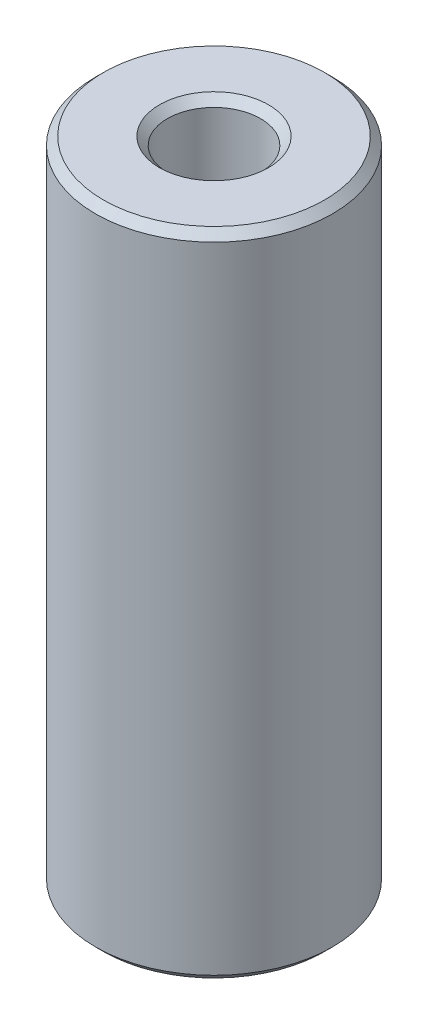
from build123d import *

# Parameters (mm, degrees)
SKETCH1_R           = 50
BOSS_EXTRUDE1_DEPTH = 274.598627487
SKETCH2_R           = 19.647794131
CUT_EXTRUDE1_DEPTH  = 284.556707234
CHAMFER1_SIZE       = 3.364109204


with BuildPart() as part:
    # Sketch1 → Boss-Extrude1 (new body)
    with BuildSketch(Plane(origin=(0, 0, 0), x_dir=(1, 0, 0), z_dir=(0, 1, 0))):
        Circle(SKETCH1_R)
    extrude(amount=BOSS_EXTRUDE1_DEPTH)

    # Sketch2 → Cut-Extrude1 (cut, through all)
    with BuildSketch(Plane(origin=(0, 0, 0), x_dir=(1, 0, 0), z_dir=(0, 1, 0))):
        Circle(SKETCH2_R)
    extrude(amount=CUT_EXTRUDE1_DEPTH, mode=Mode.SUBTRACT)

    # Chamfer1
    chamfer1_edges = [part.edges().sort_by_distance(p)[0] for p in [
        (-19.647794131, 274.598627487, 0),
        (-19.647794131, 0, 0),
        (-50, 0, 0),
        (-50, 274.598627487, 0),
    ]]
    chamfer(chamfer1_edges, length=CHAMFER1_SIZE)


solid = part.part
